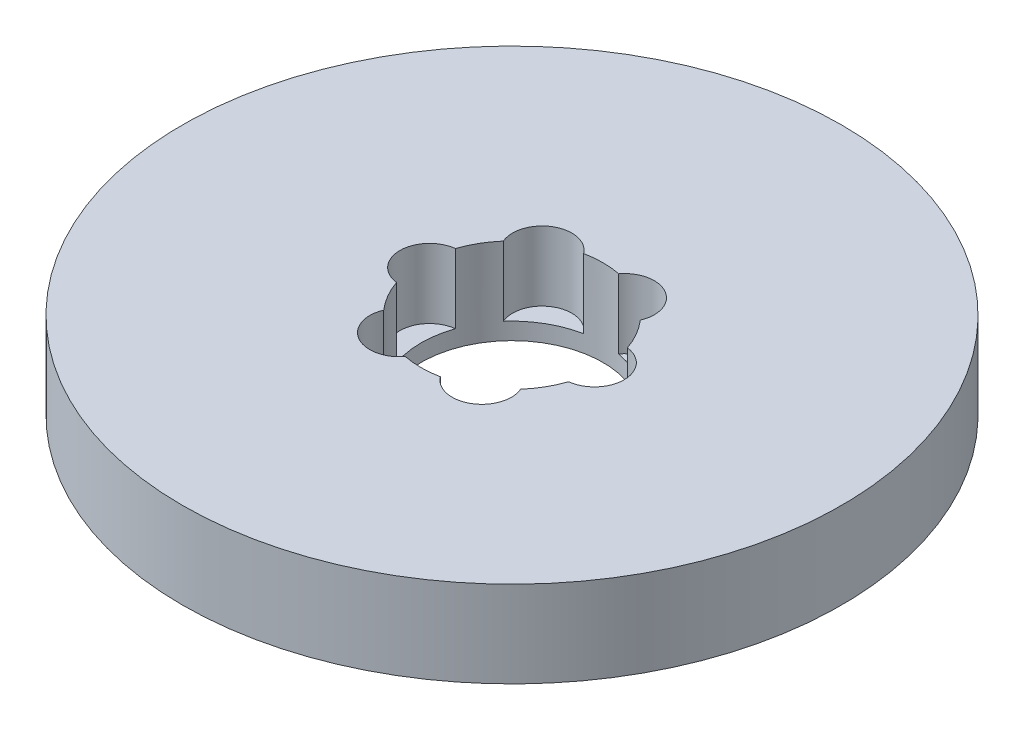
from build123d import *

# Parameters (mm, degrees)
SKETCH1_R           = 72.5
BOSS_EXTRUDE1_DEPTH = 19
SKETCH2_R           = 20
CUT_EXTRUDE1_DEPTH  = 105.276075876
SKETCH3_R           = 6.517224347
CUT_EXTRUDE2_DEPTH  = 15.27601445
CIRPATTERN1_COUNT   = 6


with BuildPart() as part:
    # Sketch1 → Boss-Extrude1 (new body)
    with BuildSketch(Plane(origin=(0, 0, 0), x_dir=(1, 0, 0), z_dir=(0, 1, 0))):
        Circle(SKETCH1_R)
    extrude(amount=BOSS_EXTRUDE1_DEPTH)

    # Sketch2 → Cut-Extrude1 (cut, through all)
    with BuildSketch(Plane(origin=(0, 0, 0), x_dir=(1, 0, 0), z_dir=(0, 1, 0))):
        Circle(SKETCH2_R)
    extrude(amount=CUT_EXTRUDE1_DEPTH, mode=Mode.SUBTRACT)

    # Sketch3 → Cut-Extrude2 (cut)
    with BuildSketch(Plane(origin=(0, 19, 0), x_dir=(1, 0, 0), z_dir=(0, 1, 0))):
        with Locations((-18.137210473, 0)):
            Circle(SKETCH3_R)
    cut_extrude2 = extrude(amount=-CUT_EXTRUDE2_DEPTH, mode=Mode.SUBTRACT)

    # CirPattern1: Cut-Extrude2 ×6 about axis
    cirpattern1_axis = Axis((0, 0, 0), (0, 1, 0))
    for i in range(1, CIRPATTERN1_COUNT):
        add(cut_extrude2.rotate(cirpattern1_axis, i * 360 / CIRPATTERN1_COUNT), mode=Mode.SUBTRACT)


solid = part.part
